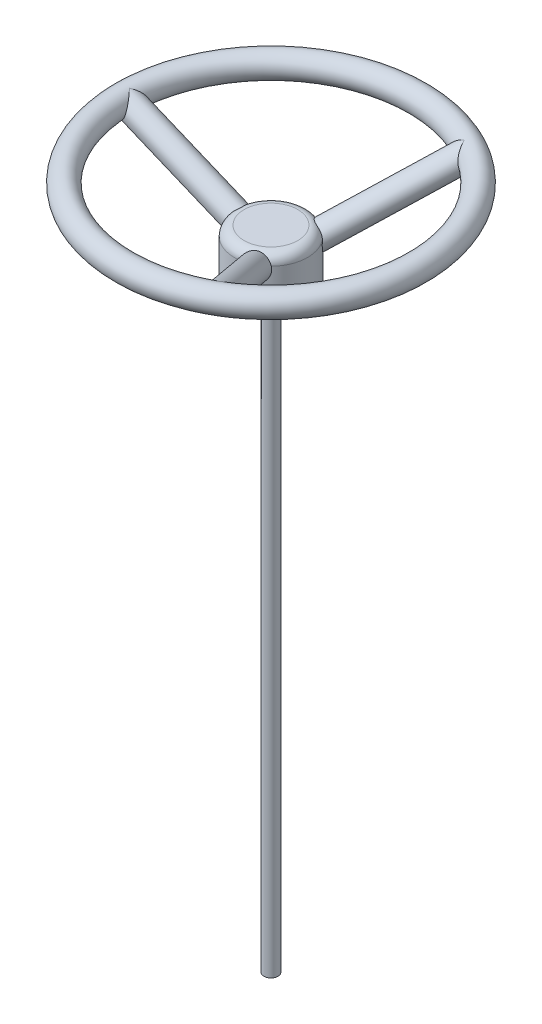
from build123d import *

# Parameters (mm, degrees)
SKETCH1_R           = 12.7
SKETCH4_R           = 38.1
BOSS_EXTRUDE1_DEPTH = 50.8
SWEEP1_PROFILE_R    = 12.7
SKETCH13_R          = 12.7
BOSS_EXTRUDE2_DEPTH = 50.8
CIRPATTERN1_COUNT   = 3
SKETCH20_R          = 7.3025
BOSS_EXTRUDE3_DEPTH = 622.3
FILLET1_R           = 10.16


with BuildPart() as part:
    # Sketch1 → Revolve1 (revolve)
    with BuildSketch(Plane.XY, mode=Mode.PRIVATE) as revolve1_sk:
        Circle(SKETCH1_R)
    revolve(revolve1_sk.sketch.rotate(Axis((152.4, -24.171508172, 0), (0, 1, 0)), 270), axis=Axis((152.4, -24.171508172, 0), (0, 1, 0)))



with BuildPart() as body_2:
    # Sketch4 → Boss-Extrude1 (new body)
    with BuildSketch(Plane(origin=(0, -38.1, 0), x_dir=(1, 0, 0), z_dir=(0, 1, 0))):
        with Locations(Location((152.4, 0, 0), (0, 0, 270))):
            Circle(SKETCH4_R)
    extrude(amount=-BOSS_EXTRUDE1_DEPTH)


with BuildPart() as part_1:
    add(part.part)

    add(body_2.part)  # Sweep1 merges body 2
    # Sweep1: sweep along a curve in space
    with BuildLine() as sweep1_path:
        Line((114.368989505, -50.8, -2.291776762), (0, 0, 0))
    # Sweep1 profile (on start of the path) → Sweep1 (sweep)
    with BuildSketch(Plane(origin=(114.368989505, -50.8, -2.291776762), x_dir=(-0.4059338560019131, -0.9139024589918872, 0), z_dir=(-0.9137492485462624, 0.4058658035458109, 0.01831011450685407))):
        Circle(SWEEP1_PROFILE_R)
    sweep1 = sweep(path=sweep1_path.line)

    # Sketch13 → Boss-Extrude2 (add)
    with BuildSketch(Plane(origin=(114.368989505, -50.8, -2.291776762), x_dir=(-0.016733658672236966, 0.007432695385603842, -0.9998323558010842), z_dir=(0.9137492485462625, -0.40586580354581087, -0.01831011450685408))):
        with Locations(Location((0, 0, 0), (0, 0, 270))):
            Circle(SKETCH13_R)
    boss_extrude2 = extrude(amount=BOSS_EXTRUDE2_DEPTH)

    # CirPattern1: Sweep1, Boss-Extrude2 ×3 about axis
    cirpattern1_axis = Axis((152.4, -38.1, 0), (0, 1, 0))
    add([sweep1.rotate(cirpattern1_axis, i * 360 / CIRPATTERN1_COUNT) for i in range(1, CIRPATTERN1_COUNT)])
    add([boss_extrude2.rotate(cirpattern1_axis, i * 360 / CIRPATTERN1_COUNT) for i in range(1, CIRPATTERN1_COUNT)])

    # Sketch20 → Boss-Extrude3 (add)
    with BuildSketch(Plane(origin=(0, -88.9, 0), x_dir=(-1, 0, 0), z_dir=(0, -1, 0))):
        with Locations(Location((-152.4, 0, 0), (0, 0, 90))):
            Circle(SKETCH20_R)
    extrude(amount=BOSS_EXTRUDE3_DEPTH)

    # Fillet1
    # the kernel refuses this fillet: 10.16 mm, written as the material it takes off along each edge
    with BuildSketch(Plane(origin=(152.4, -38.1, 0), x_dir=(-0.8308138175058877, 0, -0.5565504475259127), z_dir=(0.5565504475259127, 0, -0.8308138175058877))) as fillet1_piece_1_section:
        with BuildLine():
            CenterArc((38.1 - FILLET1_R, -FILLET1_R), FILLET1_R, 0, 90)
            Line((38.1 - FILLET1_R, 0), (38.1, 0))
            Line((38.1, 0), (38.1, -FILLET1_R))
        make_face()
    fillet1_piece_1 = revolve(axis=Axis((152.4, -38.1, 0), (0, 1, 0)), revolution_arc=123.817572288, mode=Mode.PRIVATE)
    fillet1_piece_1 = fillet1_piece_1 - Plane(origin=(116.234627505, -51.628672272, -2.329161247), x_dir=(-0.4059338560019089, -0.913902458991889, 0), z_dir=(-0.9137492485462643, 0.4058658035458067, 0.018310114506854207)) * Cylinder(12.7, 153, mode=Mode.PRIVATE)
    add(fillet1_piece_1, mode=Mode.SUBTRACT)
    with BuildSketch(Plane(origin=(152.4, -38.1, 0), x_dir=(-0.06670385164586169, 0, 0.9977728179177897), z_dir=(-0.9977728179177897, 0, -0.06670385164586169))) as fillet1_piece_2_section:
        with BuildLine():
            CenterArc((38.1 - FILLET1_R, -FILLET1_R), FILLET1_R, 0, 90)
            Line((38.1 - FILLET1_R, 0), (38.1, 0))
            Line((38.1, 0), (38.1, -FILLET1_R))
        make_face()
    fillet1_piece_2 = revolve(axis=Axis((152.4, -38.1, 0), (0, 1, 0)), revolution_arc=181.71684866, mode=Mode.PRIVATE)
    fillet1_piece_2 = fillet1_piece_2 - Plane(origin=(163.44045874, -55.943006252, 24.170229245), x_dir=(0.2029669280009543, -0.9139024589918892, 0.35154903155382744), z_dir=(0.4727316485822696, 0.4058658035458067, 0.7821750046765789)) * Cylinder(12.7, 153, mode=Mode.PRIVATE)
    fillet1_piece_2 = fillet1_piece_2 - Plane(origin=(166.047817472, -57.566391517, -18.444645623), x_dir=(0.20296692800095473, -0.9139024589918892, -0.3515490315538272), z_dir=(0.4410175999639948, 0.4058658035458067, -0.8004851191834328)) * Cylinder(12.7, 153, mode=Mode.PRIVATE)
    add(fillet1_piece_2, mode=Mode.SUBTRACT)
    with BuildSketch(Plane(origin=(152.4, -38.1, 0), x_dir=(0.8974485333453299, 0, -0.44111917890329416), z_dir=(0.44111917890329416, 0, 0.8974485333453299))) as fillet1_piece_3_section:
        with BuildLine():
            CenterArc((38.1 - FILLET1_R, -FILLET1_R), FILLET1_R, 0, 90)
            Line((38.1 - FILLET1_R, 0), (38.1, 0))
            Line((38.1, 0), (38.1, -FILLET1_R))
        make_face()
    fillet1_piece_3 = revolve(axis=Axis((152.4, -38.1, 0), (0, 1, 0)), revolution_arc=181.71684866, mode=Mode.PRIVATE)
    fillet1_piece_3 = fillet1_piece_3 - Plane(origin=(129.602559591, -57.566391517, -2.597033825), x_dir=(-0.4059338560019089, -0.913902458991889, 0), z_dir=(-0.9137492485462643, 0.4058658035458067, 0.018310114506854207)) * Cylinder(12.7, 153, mode=Mode.PRIVATE)
    fillet1_piece_3 = fillet1_piece_3 - Plane(origin=(167.811803172, -55.943006252, -21.646432361), x_dir=(0.20296692800095473, -0.9139024589918892, -0.3515490315538272), z_dir=(0.4410175999639948, 0.4058658035458067, -0.8004851191834328)) * Cylinder(12.7, 153, mode=Mode.PRIVATE)
    add(fillet1_piece_3, mode=Mode.SUBTRACT)
    with BuildSketch(Plane(origin=(152.4, -38.1, 0), x_dir=(0, 0, 1), z_dir=(-1, 0, 0))) as fillet1_piece_4_section:
        with BuildLine():
            CenterArc((38.1 - FILLET1_R, -FILLET1_R), FILLET1_R, 0, 90)
            Line((38.1 - FILLET1_R, 0), (38.1, 0))
            Line((38.1, 0), (38.1, -FILLET1_R))
        make_face()
    fillet1_piece_4 = revolve(axis=Axis((152.4, -38.1, 0), (0, 1, 0)), revolution_arc=57.871893715, mode=Mode.PRIVATE)
    fillet1_piece_4 = fillet1_piece_4 - Plane(origin=(169.043882646, -51.132162398, 33.441574061), x_dir=(0.2029669280009543, -0.9139024589918892, 0.35154903155382744), z_dir=(0.4727316485822696, 0.4058658035458067, 0.7821750046765789)) * Cylinder(12.7, 153, mode=Mode.PRIVATE)
    add(fillet1_piece_4, mode=Mode.SUBTRACT)


solid = part_1.part
